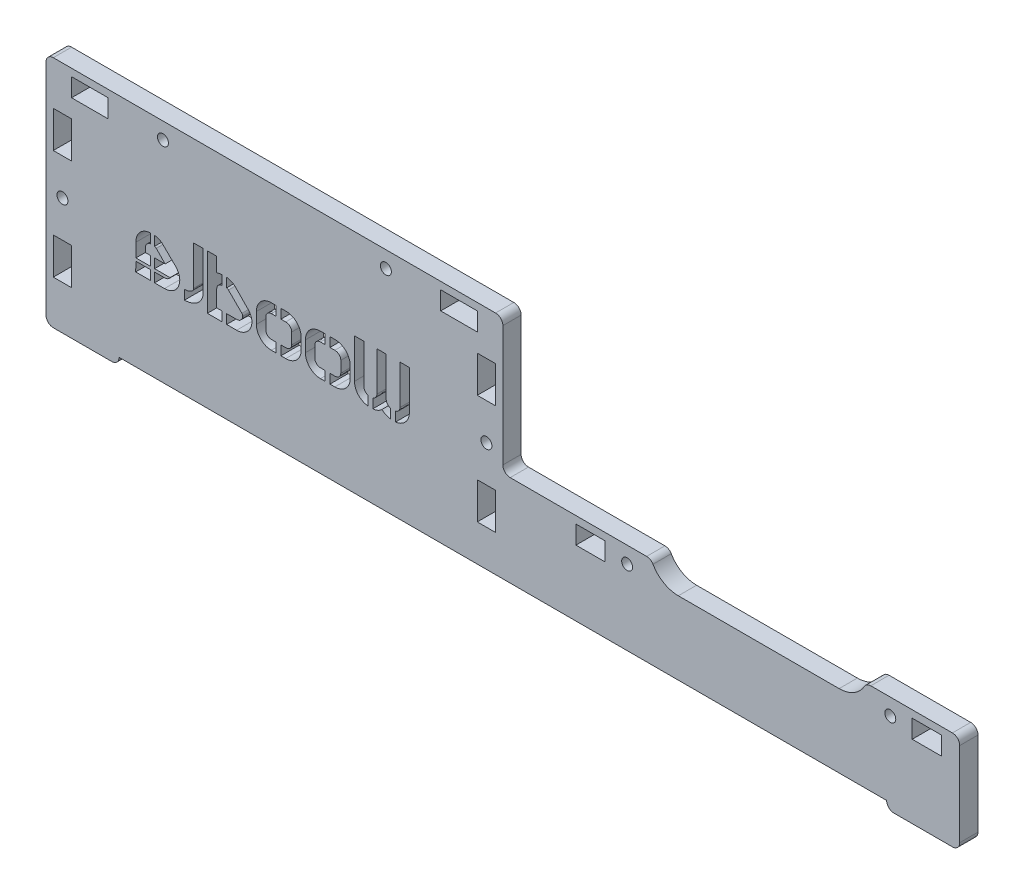
from build123d import *

# Parameters (mm, degrees)
BOSS_EXTRUDE1_DEPTH = 5
SKETCH2_R           = 1.5
SKETCH2_W           = 10
SKETCH2_H           = 5
SKETCH2_W_2         = 8
SKETCH2_W_3         = 5
SKETCH2_H_2         = 10
CUT_EXTRUDE1_DEPTH  = 259.110441478
SKETCH4_W           = 210
SKETCH4_H           = 2
CUT_EXTRUDE3_DEPTH  = 259.110441478
FILLET1_R           = 2
CUT_EXTRUDE4_DEPTH  = 259.110441478


with BuildPart() as part:
    # Sketch1 → Boss-Extrude1 (new body)
    with BuildSketch(Plane.XY):
        Polygon((0, 0), (0, 64), (125, 64), (125, 27), (250, 27), (250, 0), align=None)
    extrude(amount=BOSS_EXTRUDE1_DEPTH)

    # Sketch2 → Cut-Extrude1 (cut, through all)
    with BuildSketch(Plane.XY.offset(5)):
        with Locations((159, 22.5)):
            Circle(SKETCH2_R)
        with Locations(Location((231, 22.5, 0), (0, 0, 180))):
            Circle(SKETCH2_R)
        with Locations((120.5, 32)):
            Circle(SKETCH2_R)
        with Locations(Location((4.5, 32, 0), (0, 0, 180))):
            Circle(SKETCH2_R)
        with Locations((93, 59.5)):
            Circle(SKETCH2_R)
        with Locations(Location((32, 59.5, 0), (0, 0, 180))):
            Circle(SKETCH2_R)
        with Locations((12, 59.5)):
            Rectangle(SKETCH2_W, SKETCH2_H)
        with Locations((113, 59.5)):
            Rectangle(SKETCH2_W, SKETCH2_H)
        with Locations((241, 22.5)):
            Rectangle(SKETCH2_W_2, SKETCH2_H)
        with Locations((149, 22.5)):
            Rectangle(SKETCH2_W_2, SKETCH2_H)
        with Locations((120.5, 47)):
            Rectangle(SKETCH2_W_3, SKETCH2_H_2)
        with Locations((120.5, 17)):
            Rectangle(SKETCH2_W_3, SKETCH2_H_2)
        with Locations((4.5, 17)):
            Rectangle(SKETCH2_W_3, SKETCH2_H_2)
        with Locations((4.5, 47)):
            Rectangle(SKETCH2_W_3, SKETCH2_H_2)
        with BuildLine():
            Line((173, 22), (217, 22))
            ThreePointArc((217, 22), (225, 30), (217, 38))
            Line((217, 38), (173, 38))
            ThreePointArc((173, 38), (165, 30), (173, 22))
        make_face()
    extrude(amount=-CUT_EXTRUDE1_DEPTH, mode=Mode.SUBTRACT)

    # Sketch4 → Cut-Extrude3 (cut, through all)
    with BuildSketch(Plane.XY.offset(5)):
        with Locations((125, 1)):
            Rectangle(SKETCH4_W, SKETCH4_H)
    extrude(amount=-CUT_EXTRUDE3_DEPTH, mode=Mode.SUBTRACT)

    # Fillet1
    fillet1_edges = [part.edges().sort_by_distance(p)[0] for p in [
        (250, 0, 2.5),
        (250, 27, 2.5),
        (0, 0, 2.5),
        (125, 64, 2.5),
        (0, 64, 2.5),
        (125, 27, 2.5),
        (224.416198487, 27, 2.5),
        (165.583801513, 27, 2.5),
        (230, 0, 2.5),
        (20, 0, 2.5),
    ]]
    fillet(fillet1_edges, radius=FILLET1_R - 0.0001)  # a hair under: the kernel refuses the full size

    # Sketch5 → Cut-Extrude4 (cut, through all)
    with BuildSketch(Plane.XY.offset(5)):
        with BuildLine():
            add(Edge.make_bspline(
                [(90.526315789, 28.530633224), (90.52317309, 28.44800455), (90.51696156, 28.284689386), (90.454699796, 28.047497494), (90.358878759, 27.821672389), (90.222801605, 27.614523519), (90.058774914, 27.428168104), (89.863305687, 27.281251284), (89.652003493, 27.157508241), (89.495546745, 27.110991684), (89.416118421, 27.087376645)],
                knots=[0, 0, 0, 0, 1.010227084, 1.996708827, 2.983833333, 4.003745822, 5.020232118, 6.007597553, 6.988517975, 8, 8, 8, 8], degree=3))
            Line((89.416118421, 27.087376645), (89.416118421, 24.5))
            add(Edge.make_bspline(
                [(89.416118421, 24.5), (89.532483004, 24.513957205), (89.763361627, 24.541649655), (90.104345561, 24.608756184), (90.435530372, 24.706429474), (90.759545958, 24.824830878), (91.069862023, 24.97311561), (91.365921002, 25.145689998), (91.642011703, 25.350706729), (91.810588547, 25.506831888), (91.895559211, 25.585526316)],
                knots=[0, 0, 0, 0, 1.018810117, 2.021418134, 3.017070451, 4.018163531, 5.0176195, 6.003232589, 6.993535249, 8, 8, 8, 8], degree=3))
            add(Edge.make_bspline(
                [(91.895559211, 25.585526316), (92.067693526, 25.449668125), (92.415579674, 25.175096593), (92.90790607, 24.912313221), (93.321577862, 24.740758728), (93.640772924, 24.630066138), (93.970508455, 24.550542946), (94.194816296, 24.516866104), (94.307154605, 24.5)],
                knots=[0, 0, 0, 0, 1.470266527, 2.97143169, 3.726468338, 4.477360312, 5.237428497, 6, 6, 6, 6], degree=3))
            Line((94.307154605, 24.5), (94.307154605, 27.087376645))
            add(Edge.make_bspline(
                [(94.307154605, 27.087376645), (94.224819632, 27.111245566), (94.061011228, 27.158733647), (93.835641953, 27.280719426), (93.624839285, 27.428330364), (93.442563503, 27.6136278), (93.288177936, 27.820090708), (93.175710198, 28.045476839), (93.103326392, 28.283612842), (93.095864136, 28.447885914), (93.092105263, 28.530633224)],
                knots=[0, 0, 0, 0, 1.01260259, 2.014609424, 3.018094582, 4.051204175, 5.07884678, 6.058940596, 7.022253355, 8, 8, 8, 8], degree=3))
            Line((93.092105263, 28.530633224), (93.092105263, 39.302631579))
            Line((93.092105263, 39.302631579), (90.526315789, 39.302631579))
            Line((90.526315789, 39.302631579), (90.526315789, 28.530633224))
        make_face()
        with BuildLine():
            add(Edge.make_bspline(
                [(84.407894737, 28.530633224), (84.412002513, 28.400994106), (84.420117177, 28.14489981), (84.468190801, 27.764955091), (84.560149032, 27.398454323), (84.679650219, 27.043120334), (84.830571341, 26.702897231), (85.013346715, 26.38305727), (85.220965238, 26.080273746), (85.45803375, 25.800753805), (85.722248178, 25.543756552), (86.008147316, 25.309209303), (86.319872019, 25.10023342), (86.654532474, 24.921345661), (87.006587834, 24.763680601), (87.378042676, 24.64723719), (87.761446993, 24.550051061), (88.024787858, 24.516804587), (88.157894737, 24.5)],
                knots=[0, 0, 0, 0, 1.028666461, 2.032068855, 3.03088781, 4.021147977, 5.003147261, 5.978214699, 6.939579792, 7.911675967, 8.88048293, 9.859905496, 10.84149838, 11.852230519, 12.867361305, 13.896318637, 14.936684362, 16, 16, 16, 16], degree=3))
            Line((88.157894737, 24.5), (88.157894737, 27.087376645))
            add(Edge.make_bspline(
                [(88.157894737, 27.087376645), (88.075527751, 27.111158326), (87.912532832, 27.158219576), (87.68979943, 27.279974818), (87.484746079, 27.428730216), (87.308179966, 27.613734265), (87.1609978, 27.821263934), (87.049685243, 28.045061728), (86.986681982, 28.284645375), (86.978047921, 28.448048308), (86.973684211, 28.530633224)],
                knots=[0, 0, 0, 0, 1.022011913, 2.022445629, 3.015379681, 4.040857925, 5.06368216, 6.04744906, 7.013167921, 8, 8, 8, 8], degree=3))
            Line((86.973684211, 28.530633224), (86.973684211, 39.302631579))
            Line((86.973684211, 39.302631579), (84.407894737, 39.302631579))
            Line((84.407894737, 39.302631579), (84.407894737, 28.530633224))
        make_face()
        with BuildLine():
            add(Edge.make_bspline(
                [(96.842105263, 28.530633224), (96.837800239, 28.448023625), (96.829282297, 28.284571854), (96.765532622, 28.045783321), (96.658149625, 27.821460372), (96.513905697, 27.612854918), (96.337021169, 27.42893981), (96.131652796, 27.279047955), (95.90614863, 27.158316901), (95.741247414, 27.111195245), (95.657894737, 27.087376645)],
                knots=[0, 0, 0, 0, 0.985573412, 1.950060536, 2.927269449, 3.941761156, 4.965931442, 5.957599044, 6.967626846, 8, 8, 8, 8], degree=3))
            Line((95.657894737, 27.087376645), (95.657894737, 24.5))
            add(Edge.make_bspline(
                [(95.657894737, 24.5), (95.784844364, 24.516863113), (96.036973322, 24.550354184), (96.404900625, 24.647631245), (96.763867563, 24.764424078), (97.106155676, 24.920998845), (97.432726228, 25.10289721), (97.74328526, 25.308663917), (98.028983161, 25.545727226), (98.299406012, 25.800212892), (98.54190311, 26.081099452), (98.75952056, 26.38249344), (98.950452155, 26.703374361), (99.114959495, 27.041941875), (99.24382677, 27.397713629), (99.34079162, 27.764684121), (99.397374643, 28.144412517), (99.404361692, 28.400925719), (99.407894737, 28.530633224)],
                knots=[0, 0, 0, 0, 1.02041224, 2.026594961, 3.029967857, 4.028101524, 5.022727038, 6.009617966, 6.994326862, 7.980161472, 8.968175627, 9.948917217, 10.941614734, 11.942707234, 12.946482016, 13.954700296, 14.96578142, 16, 16, 16, 16], degree=3))
            Line((99.407894737, 28.530633224), (99.407894737, 39.302631579))
            Line((99.407894737, 39.302631579), (96.842105263, 39.302631579))
            Line((96.842105263, 39.302631579), (96.842105263, 28.530633224))
        make_face()
        with BuildLine():
            add(Edge.make_bspline(
                [(79.017269737, 33.184210526), (79.126808454, 33.179287767), (79.342284111, 33.169604116), (79.652394532, 33.080587387), (79.93524229, 32.931826201), (80.185278506, 32.73227072), (80.396021034, 32.494976093), (80.546154165, 32.224058285), (80.640506647, 31.931098369), (80.652038843, 31.727268498), (80.657894737, 31.623766447)],
                knots=[0, 0, 0, 0, 1.043825976, 2.053329579, 3.049585033, 4.076299473, 5.091651461, 6.058032298, 7.013895072, 8, 8, 8, 8], degree=3))
            Line((80.657894737, 31.623766447), (80.657894737, 28.586143092))
            add(Edge.make_bspline(
                [(80.657894737, 28.586143092), (80.651889296, 28.485761159), (80.64000189, 28.287061197), (80.547012767, 28.001444686), (80.393667653, 27.738824896), (80.186350023, 27.504856503), (79.933922506, 27.312288277), (79.652277284, 27.16584141), (79.341780074, 27.081237625), (79.126731394, 27.071000341), (79.017269737, 27.065789474)],
                knots=[0, 0, 0, 0, 0.968952361, 1.917982567, 2.870698946, 3.891457366, 4.918964356, 5.923292062, 6.942937516, 8, 8, 8, 8], degree=3))
            Line((79.017269737, 27.065789474), (77.694284539, 27.065789474))
            Line((77.694284539, 27.065789474), (77.694284539, 24.5))
            Line((77.694284539, 24.5), (79.017269737, 24.5))
            add(Edge.make_bspline(
                [(79.017269737, 24.5), (79.16443957, 24.50456345), (79.453783519, 24.513535442), (79.881030966, 24.57225931), (80.29128657, 24.675735026), (80.686814326, 24.812734303), (81.057262971, 24.990049839), (81.406858211, 25.190331919), (81.727792482, 25.422367684), (82.022371035, 25.682473868), (82.288033918, 25.969623798), (82.524239944, 26.28398503), (82.730090511, 26.623099838), (82.906857763, 26.984959644), (83.048311862, 27.365857354), (83.151211552, 27.762385908), (83.210066675, 28.173196398), (83.219102523, 28.451297692), (83.223684211, 28.592310855)],
                knots=[0, 0, 0, 0, 1.080806525, 2.124924803, 3.159392374, 4.183645534, 5.193357222, 6.170922564, 7.138880151, 8.096181651, 9.052411011, 10.006611931, 10.978916479, 11.961395482, 12.959812438, 13.957687, 14.964431228, 16, 16, 16, 16], degree=3))
            Line((83.223684211, 28.592310855), (83.223684211, 31.636101974))
            add(Edge.make_bspline(
                [(83.223684211, 31.636101974), (83.219116813, 31.780200922), (83.210107283, 32.06444679), (83.151025344, 32.484361504), (83.049548205, 32.888558024), (82.906000346, 33.274870261), (82.730913512, 33.641582265), (82.525020486, 33.983981105), (82.28800621, 34.298892312), (82.022231616, 34.585811636), (81.728829597, 34.846600387), (81.405608244, 35.074220331), (81.058929957, 35.276780543), (80.685673854, 35.445433887), (80.291346794, 35.581062478), (79.880547142, 35.679717556), (79.4539267, 35.740581156), (79.164472632, 35.746824782), (79.017269737, 35.75)],
                knots=[0, 0, 0, 0, 1.053003276, 2.077127084, 3.091951553, 4.09252401, 5.083718505, 6.05768351, 7.007210062, 7.958755116, 8.911367059, 9.870208281, 10.842984798, 11.841440058, 12.858208903, 13.885825724, 14.924829153, 16, 16, 16, 16], degree=3))
            Line((79.017269737, 35.75), (77.694284539, 35.75))
            Line((77.694284539, 35.75), (77.694284539, 33.184210526))
            Line((77.694284539, 33.184210526), (79.017269737, 33.184210526))
        make_face()
        with BuildLine():
            add(Edge.make_bspline(
                [(75.088404605, 35.75), (74.948411635, 35.746649784), (74.670258231, 35.739993207), (74.260766897, 35.680586344), (73.864803956, 35.579947582), (73.483689237, 35.445003987), (73.120067005, 35.275823475), (72.780345568, 35.07524435), (72.465966706, 34.845315976), (72.178426823, 34.586070661), (71.91982832, 34.296748404), (71.681639776, 33.985145895), (71.480298143, 33.640534542), (71.304276572, 33.275026017), (71.161046218, 32.888515489), (71.059482532, 32.484373021), (71.000423813, 32.064443804), (70.991411111, 31.780199918), (70.986842105, 31.636101974)],
                knots=[0, 0, 0, 0, 1.037637347, 2.061691803, 3.059976681, 4.062877695, 5.055208535, 6.029101085, 6.983469214, 7.938689241, 8.893909267, 9.857365668, 10.841701768, 11.847437394, 12.862688559, 13.892400818, 14.93154884, 16, 16, 16, 16], degree=3))
            Line((70.986842105, 31.636101974), (70.986842105, 28.592310855))
            add(Edge.make_bspline(
                [(70.986842105, 28.592310855), (70.991425357, 28.451298676), (71.000464289, 28.173199323), (71.059296837, 27.762374628), (71.162281095, 27.365899289), (71.303421198, 26.984803993), (71.481103333, 26.624145535), (71.682421586, 26.282813178), (71.919804233, 25.971770651), (72.178283477, 25.682215836), (72.467019602, 25.42363131), (72.779076161, 25.189330727), (73.121766996, 24.990988163), (73.482542928, 24.813201425), (73.864874503, 24.67686703), (74.260259052, 24.571380885), (74.670408681, 24.514139665), (74.948445793, 24.504734426), (75.088404605, 24.5)],
                knots=[0, 0, 0, 0, 1.050812842, 2.072376829, 3.084940585, 4.098054719, 5.094996286, 6.077650631, 7.045897848, 8.005867735, 8.965837622, 9.929498483, 10.908233743, 11.912067335, 12.92254273, 13.927690681, 14.956837279, 16, 16, 16, 16], degree=3))
            Line((75.088404605, 24.5), (76.303453947, 24.5))
            Line((76.303453947, 24.5), (76.303453947, 27.065789474))
            Line((76.303453947, 27.065789474), (75.088404605, 27.065789474))
            add(Edge.make_bspline(
                [(75.088404605, 27.065789474), (74.985020817, 27.070821072), (74.782911545, 27.080657552), (74.491341931, 27.167546057), (74.227022901, 27.31182598), (73.991926766, 27.506403131), (73.801462473, 27.741901815), (73.65342143, 28.001725506), (73.568296414, 28.287972143), (73.557898164, 28.485896742), (73.552631579, 28.586143092)],
                knots=[0, 0, 0, 0, 1.031941725, 2.01738583, 3.010730696, 4.025329363, 5.047861792, 6.023177512, 6.998763965, 8, 8, 8, 8], degree=3))
            Line((73.552631579, 28.586143092), (73.552631579, 31.623766447))
            add(Edge.make_bspline(
                [(73.552631579, 31.623766447), (73.557757279, 31.727131111), (73.567826728, 31.93019124), (73.654264604, 32.223818131), (73.799217188, 32.491805913), (73.993026979, 32.730789113), (74.225669065, 32.932212877), (74.491241178, 33.078849443), (74.782369991, 33.170180852), (74.984937421, 33.179467236), (75.088404605, 33.184210526)],
                knots=[0, 0, 0, 0, 1.018371753, 2.00059374, 2.989808205, 4.00676471, 5.021087658, 6.006237912, 6.981628247, 8, 8, 8, 8], degree=3))
            Line((75.088404605, 33.184210526), (76.303453947, 33.184210526))
            Line((76.303453947, 33.184210526), (76.303453947, 35.75))
            Line((76.303453947, 35.75), (75.088404605, 35.75))
        make_face()
        with BuildLine():
            add(Edge.make_bspline(
                [(65.596217105, 33.184210526), (65.705755822, 33.179287767), (65.921231479, 33.169604116), (66.231341901, 33.080587387), (66.514189659, 32.931826201), (66.764225874, 32.73227072), (66.974968402, 32.494976093), (67.125101534, 32.224058285), (67.219454015, 31.931098369), (67.230986212, 31.727268498), (67.236842105, 31.623766447)],
                knots=[0, 0, 0, 0, 1.043825976, 2.053329579, 3.049585033, 4.076299473, 5.091651461, 6.058032298, 7.013895072, 8, 8, 8, 8], degree=3))
            Line((67.236842105, 31.623766447), (67.236842105, 28.586143092))
            add(Edge.make_bspline(
                [(67.236842105, 28.586143092), (67.230836665, 28.485761159), (67.218949259, 28.287061197), (67.125960136, 28.001444686), (66.972615021, 27.738824896), (66.765297391, 27.504856503), (66.512869874, 27.312288277), (66.231224653, 27.16584141), (65.920727442, 27.081237625), (65.705678762, 27.071000341), (65.596217105, 27.065789474)],
                knots=[0, 0, 0, 0, 0.968952361, 1.917982567, 2.870698946, 3.891457366, 4.918964356, 5.923292062, 6.942937516, 8, 8, 8, 8], degree=3))
            Line((65.596217105, 27.065789474), (64.273231908, 27.065789474))
            Line((64.273231908, 27.065789474), (64.273231908, 24.5))
            Line((64.273231908, 24.5), (65.596217105, 24.5))
            add(Edge.make_bspline(
                [(65.596217105, 24.5), (65.743386938, 24.50456345), (66.032730887, 24.513535442), (66.459978334, 24.57225931), (66.870233939, 24.675735026), (67.265761694, 24.812734303), (67.63621034, 24.990049839), (67.985805579, 25.190331919), (68.306739851, 25.422367684), (68.601318404, 25.682473868), (68.866981286, 25.969623798), (69.103187312, 26.28398503), (69.30903788, 26.623099838), (69.485805131, 26.984959644), (69.62725923, 27.365857354), (69.730158921, 27.762385908), (69.789014044, 28.173196398), (69.798049891, 28.451297692), (69.802631579, 28.592310855)],
                knots=[0, 0, 0, 0, 1.080806525, 2.124924803, 3.159392374, 4.183645534, 5.193357222, 6.170922564, 7.138880151, 8.096181651, 9.052411011, 10.006611931, 10.978916479, 11.961395482, 12.959812438, 13.957687, 14.964431228, 16, 16, 16, 16], degree=3))
            Line((69.802631579, 28.592310855), (69.802631579, 31.636101974))
            add(Edge.make_bspline(
                [(69.802631579, 31.636101974), (69.798064181, 31.780200922), (69.789054651, 32.06444679), (69.729972712, 32.484361504), (69.628495574, 32.888558024), (69.484947714, 33.274870261), (69.30986088, 33.641582265), (69.103967855, 33.983981105), (68.866953578, 34.298892312), (68.601178984, 34.585811636), (68.307776965, 34.846600387), (67.984555613, 35.074220331), (67.637877326, 35.276780543), (67.264621222, 35.445433887), (66.870294162, 35.581062478), (66.459494511, 35.679717556), (66.032874068, 35.740581156), (65.743420001, 35.746824782), (65.596217105, 35.75)],
                knots=[0, 0, 0, 0, 1.053003276, 2.077127084, 3.091951553, 4.09252401, 5.083718505, 6.05768351, 7.007210062, 7.958755116, 8.911367059, 9.870208281, 10.842984798, 11.841440058, 12.858208903, 13.885825724, 14.924829153, 16, 16, 16, 16], degree=3))
            Line((65.596217105, 35.75), (64.273231908, 35.75))
            Line((64.273231908, 35.75), (64.273231908, 33.184210526))
            Line((64.273231908, 33.184210526), (65.596217105, 33.184210526))
        make_face()
        with BuildLine():
            add(Edge.make_bspline(
                [(61.667351974, 35.75), (61.527359003, 35.746649784), (61.249205599, 35.739993207), (60.839714266, 35.680586344), (60.443751324, 35.579947582), (60.062636605, 35.445003987), (59.699014374, 35.275823475), (59.359292937, 35.07524435), (59.044914075, 34.845315976), (58.757374192, 34.586070661), (58.498775688, 34.296748404), (58.260587144, 33.985145895), (58.059245512, 33.640534542), (57.883223941, 33.275026017), (57.739993587, 32.888515489), (57.6384299, 32.484373021), (57.579371182, 32.064443804), (57.570358479, 31.780199918), (57.565789474, 31.636101974)],
                knots=[0, 0, 0, 0, 1.037637347, 2.061691803, 3.059976681, 4.062877695, 5.055208535, 6.029101085, 6.983469214, 7.938689241, 8.893909267, 9.857365668, 10.841701768, 11.847437394, 12.862688559, 13.892400818, 14.93154884, 16, 16, 16, 16], degree=3))
            Line((57.565789474, 31.636101974), (57.565789474, 28.592310855))
            add(Edge.make_bspline(
                [(57.565789474, 28.592310855), (57.570372726, 28.451298676), (57.579411657, 28.173199323), (57.638244205, 27.762374628), (57.741228463, 27.365899289), (57.882368567, 26.984803993), (58.060050702, 26.624145535), (58.261368954, 26.282813178), (58.498751602, 25.971770651), (58.757230846, 25.682215836), (59.04596697, 25.42363131), (59.358023529, 25.189330727), (59.700714364, 24.990988163), (60.061490297, 24.813201425), (60.443821871, 24.67686703), (60.83920642, 24.571380885), (61.249356049, 24.514139665), (61.527393161, 24.504734426), (61.667351974, 24.5)],
                knots=[0, 0, 0, 0, 1.050812842, 2.072376829, 3.084940585, 4.098054719, 5.094996286, 6.077650631, 7.045897848, 8.005867735, 8.965837622, 9.929498483, 10.908233743, 11.912067335, 12.92254273, 13.927690681, 14.956837279, 16, 16, 16, 16], degree=3))
            Line((61.667351974, 24.5), (62.882401316, 24.5))
            Line((62.882401316, 24.5), (62.882401316, 27.065789474))
            Line((62.882401316, 27.065789474), (61.667351974, 27.065789474))
            add(Edge.make_bspline(
                [(61.667351974, 27.065789474), (61.563968185, 27.070821072), (61.361858913, 27.080657552), (61.0702893, 27.167546057), (60.805970269, 27.31182598), (60.570874135, 27.506403131), (60.380409841, 27.741901815), (60.232368799, 28.001725506), (60.147243782, 28.287972143), (60.136845532, 28.485896742), (60.131578947, 28.586143092)],
                knots=[0, 0, 0, 0, 1.031941725, 2.01738583, 3.010730696, 4.025329363, 5.047861792, 6.023177512, 6.998763965, 8, 8, 8, 8], degree=3))
            Line((60.131578947, 28.586143092), (60.131578947, 31.623766447))
            add(Edge.make_bspline(
                [(60.131578947, 31.623766447), (60.136704647, 31.727131111), (60.146774097, 31.93019124), (60.233211973, 32.223818131), (60.378164557, 32.491805913), (60.571974348, 32.730789113), (60.804616434, 32.932212877), (61.070188546, 33.078849443), (61.361317359, 33.170180852), (61.563884789, 33.179467236), (61.667351974, 33.184210526)],
                knots=[0, 0, 0, 0, 1.018371753, 2.00059374, 2.989808205, 4.00676471, 5.021087658, 6.006237912, 6.981628247, 8, 8, 8, 8], degree=3))
            Line((61.667351974, 33.184210526), (62.882401316, 33.184210526))
            Line((62.882401316, 33.184210526), (62.882401316, 35.75))
            Line((62.882401316, 35.75), (61.667351974, 35.75))
        make_face()
        with BuildLine():
            Line((48.092105263, 27.065789474), (46.710526316, 27.065789474))
            Line((46.710526316, 27.065789474), (46.710526316, 31.583675987))
            add(Edge.make_bspline(
                [(46.710526316, 31.583675987), (46.714947311, 31.679810263), (46.723597131, 31.867900112), (46.801541026, 32.138971905), (46.925925916, 32.389742475), (47.1004858, 32.612786787), (47.306199449, 32.807667193), (47.546716213, 32.953802259), (47.809140187, 33.060086718), (47.996596756, 33.089197671), (48.092105263, 33.104029605)],
                knots=[0, 0, 0, 0, 1.022761326, 2.001065903, 2.98108702, 3.989187733, 5.004881638, 5.983983554, 6.97284623, 8, 8, 8, 8], degree=3))
            Line((48.092105263, 33.104029605), (48.092105263, 35.638980263))
            add(Edge.make_bspline(
                [(48.092105263, 35.638980263), (47.964489878, 35.630120539), (47.718922351, 35.613071965), (47.36289489, 35.565165689), (47.026986214, 35.505064147), (46.814802524, 35.437707313), (46.710526316, 35.404605263)],
                knots=[0, 0, 0, 0, 1.091901524, 2.10112249, 3.066809764, 4, 4, 4, 4], degree=3))
            Line((46.710526316, 35.404605263), (46.710526316, 39.302631579))
            Line((46.710526316, 39.302631579), (44.144736842, 39.302631579))
            Line((44.144736842, 39.302631579), (44.144736842, 24.5))
            Line((44.144736842, 24.5), (48.092105263, 24.5))
            Line((48.092105263, 24.5), (48.092105263, 27.065789474))
        make_face()
        with BuildLine():
            add(Edge.make_bspline(
                [(52.156661184, 24.5), (52.296640734, 24.504624784), (52.573701549, 24.513778597), (52.984525045, 24.572596956), (53.382414315, 24.676136514), (53.768436215, 24.813548211), (54.133613318, 24.99013266), (54.479465102, 25.19522973), (54.802826833, 25.429224178), (55.103113797, 25.691622105), (55.37498596, 25.981809544), (55.616427988, 26.29878421), (55.829296608, 26.638262341), (56.012483828, 26.999575393), (56.158181348, 27.381578798), (56.258860962, 27.78227286), (56.322752727, 28.197584298), (56.331094018, 28.480029059), (56.335320724, 28.623149671)],
                knots=[0, 0, 0, 0, 1.030836197, 2.040328881, 3.048259431, 4.053913456, 5.05270677, 6.030248274, 7.011417249, 7.987697692, 8.962392167, 9.934378662, 10.917298058, 11.909183209, 12.912983755, 13.920914305, 14.946484204, 16, 16, 16, 16], degree=3))
            add(Edge.make_bspline(
                [(56.335320724, 28.623149671), (56.33050681, 28.733350302), (56.320769897, 28.956248741), (56.261508991, 29.291308191), (56.156477354, 29.625878595), (56.019323349, 29.958240834), (55.85096567, 30.280349106), (55.655089985, 30.581492346), (55.444489594, 30.865433806), (55.283460377, 31.034230444), (55.203536184, 31.118009868)],
                knots=[0, 0, 0, 0, 0.943171208, 1.907714943, 2.901026669, 3.938269626, 4.980869203, 6.00561774, 7.0101213, 8, 8, 8, 8], degree=3))
            add(Edge.make_bspline(
                [(55.203536184, 31.118009868), (54.922966761, 31.41613843), (54.358424519, 32.016011948), (53.489992996, 32.898484539), (52.615194912, 33.774354926), (52.038996658, 34.362808283), (51.752672697, 34.655222039)],
                knots=[0, 0, 0, 0, 0.994061606, 2.000181492, 3.006251836, 4, 4, 4, 4], degree=3))
            add(Edge.make_bspline(
                [(51.752672697, 34.655222039), (51.687760505, 34.713840813), (51.548654616, 34.839459996), (51.308816651, 35.015718198), (51.034275848, 35.186516358), (50.726677662, 35.333088412), (50.402472156, 35.45904674), (50.07273829, 35.573883594), (49.748024337, 35.663801426), (49.530680592, 35.68878759), (49.427425987, 35.700657895)],
                knots=[0, 0, 0, 0, 0.810069558, 1.735967344, 2.753782946, 3.801817255, 4.887904665, 5.975369697, 7.038148522, 8, 8, 8, 8], degree=3))
            Line((49.427425987, 35.700657895), (49.427425987, 33.162623355))
            add(Edge.make_bspline(
                [(49.427425987, 33.162623355), (49.521253075, 33.137138483), (49.703582465, 33.087615032), (49.847773253, 32.96579323), (49.917763158, 32.906661184)],
                knots=[0, 0, 0, 0, 1.029204218, 2, 2, 2, 2], degree=3))
            add(Edge.make_bspline(
                [(49.917763158, 32.906661184), (50.128632913, 32.69709546), (50.531295614, 32.29692285), (51.104006735, 31.72345531), (51.621941338, 31.205206925), (52.088939219, 30.739839556), (52.508230445, 30.315183225), (52.892799421, 29.931861483), (53.247300766, 29.577070601), (53.474497922, 29.349909138), (53.584498355, 29.239925987)],
                knots=[0, 0, 0, 0, 1.375948511, 2.627418722, 3.751050578, 4.767029082, 5.678724609, 6.513038083, 7.280068212, 8, 8, 8, 8], degree=3))
            add(Edge.make_bspline(
                [(53.584498355, 29.239925987), (53.617425017, 29.201193591), (53.686295414, 29.120179746), (53.751713168, 28.964257692), (53.792436228, 28.781545803), (53.795597831, 28.650145492), (53.797286184, 28.579975329)],
                knots=[0, 0, 0, 0, 0.853961671, 1.78617196, 2.817775449, 4, 4, 4, 4], degree=3))
            add(Edge.make_bspline(
                [(53.797286184, 28.579975329), (53.791599389, 28.479477842), (53.780453737, 28.282510993), (53.683947031, 27.999468135), (53.535228595, 27.736270847), (53.324416622, 27.504949195), (53.073500527, 27.312140957), (52.791618677, 27.165880933), (52.481184654, 27.081227255), (52.266127271, 27.070996843), (52.156661184, 27.065789474)],
                knots=[0, 0, 0, 0, 0.971104243, 1.903284826, 2.866750735, 3.882332976, 4.912121888, 5.918680039, 6.940589956, 8, 8, 8, 8], degree=3))
            Line((52.156661184, 27.065789474), (49.427425987, 27.065789474))
            Line((49.427425987, 27.065789474), (49.427425987, 24.5))
            Line((49.427425987, 24.5), (52.156661184, 24.5))
        make_face()
        with BuildLine():
            Line((40.394736842, 39.302631579), (40.394736842, 28.567639803))
            add(Edge.make_bspline(
                [(40.394736842, 28.567639803), (40.392385922, 28.516009375), (40.387670572, 28.412451821), (40.348856477, 28.261857951), (40.290013182, 28.116716506), (40.17382955, 27.931457346), (39.97370352, 27.715399426), (39.668248895, 27.489084812), (39.292435896, 27.308691143), (38.865030221, 27.167254284), (38.393656035, 27.0803431), (38.066770049, 27.070708481), (37.899876645, 27.065789474)],
                knots=[0, 0, 0, 0, 0.485141942, 0.973071803, 1.454439018, 1.953739644, 3.022040114, 4.20395727, 5.510241927, 6.926347096, 8.430729922, 10, 10, 10, 10], degree=3))
            Line((37.899876645, 27.065789474), (37.899876645, 24.5))
            add(Edge.make_bspline(
                [(37.899876645, 24.5), (38.071756642, 24.502918487), (38.412548898, 24.50870507), (38.915460823, 24.57427307), (39.404843321, 24.671046411), (39.874926304, 24.809978673), (40.321566342, 24.983225351), (40.741582674, 25.181856133), (41.129201264, 25.411714416), (41.48576008, 25.667075572), (41.805942421, 25.952247013), (42.096823477, 26.258645256), (42.34903843, 26.593872355), (42.570549941, 26.949549916), (42.741601425, 27.329871285), (42.870604039, 27.723040448), (42.946390666, 28.130927057), (42.955790427, 28.406972458), (42.960526316, 28.546052632)],
                knots=[0, 0, 0, 0, 1.148217981, 2.276610438, 3.3842901, 4.480099663, 5.548133976, 6.583851855, 7.581963842, 8.55645292, 9.510525177, 10.443835217, 11.375575775, 12.310073828, 13.238692883, 14.155672564, 15.070771048, 16, 16, 16, 16], degree=3))
            Line((42.960526316, 28.546052632), (42.960526316, 39.302631579))
            Line((42.960526316, 39.302631579), (40.394736842, 39.302631579))
        make_face()
        with BuildLine():
            Line((32.589432566, 30.421052632), (29.712171053, 30.421052632))
            Line((29.712171053, 30.421052632), (29.712171053, 27.855263158))
            Line((29.712171053, 27.855263158), (33.934004934, 27.855263158))
            add(Edge.make_bspline(
                [(33.934004934, 27.855263158), (33.901865334, 27.799561002), (33.836166345, 27.685696013), (33.701561486, 27.535015053), (33.53695306, 27.401233908), (33.348623753, 27.281510244), (33.134969178, 27.187606583), (32.907871304, 27.115552247), (32.666860342, 27.075888175), (32.503215889, 27.069198619), (32.419819079, 27.065789474)],
                knots=[0, 0, 0, 0, 0.860078926, 1.758152369, 2.687688369, 3.696714125, 4.738770742, 5.806285518, 6.882034885, 8, 8, 8, 8], degree=3))
            Line((32.419819079, 27.065789474), (29.712171053, 27.065789474))
            Line((29.712171053, 27.065789474), (29.712171053, 24.5))
            Line((29.712171053, 24.5), (32.419819079, 24.5))
            add(Edge.make_bspline(
                [(32.419819079, 24.5), (32.565947554, 24.504681238), (32.855254029, 24.513949195), (33.281651601, 24.571557656), (33.690831634, 24.67572225), (34.083087261, 24.813025004), (34.452989601, 24.989847186), (34.798731095, 25.196492678), (35.11943335, 25.431357948), (35.408405499, 25.69833895), (35.673645728, 25.988233023), (35.902514729, 26.307623917), (36.109316172, 26.646523083), (36.285383971, 27.009130599), (36.422777284, 27.395217233), (36.526554927, 27.797284463), (36.584746733, 28.216439324), (36.593859092, 28.500653805), (36.598478618, 28.644736842)],
                knots=[0, 0, 0, 0, 1.069398265, 2.117204337, 3.140644575, 4.15411307, 5.153386037, 6.135065398, 7.097890291, 8.056209303, 9.009467126, 9.967845176, 10.926311773, 11.912017256, 12.911318532, 13.920170855, 14.945626909, 16, 16, 16, 16], degree=3))
            add(Edge.make_bspline(
                [(36.598478618, 28.644736842), (36.596154417, 28.754988296), (36.591500855, 28.975735958), (36.533733385, 29.302137441), (36.456934207, 29.627081935), (36.335836132, 29.940985521), (36.200399043, 30.246587691), (36.044763619, 30.532291981), (35.882216302, 30.800535404), (35.760885073, 30.965669763), (35.701069079, 31.047080592)],
                knots=[0, 0, 0, 0, 1.012978646, 2.028206055, 3.041978951, 4.080201473, 5.117217361, 6.115746689, 7.071067793, 8, 8, 8, 8], degree=3))
            Line((35.701069079, 31.047080592), (31.994243421, 34.698396382))
            add(Edge.make_bspline(
                [(31.994243421, 34.698396382), (31.920604872, 34.768901835), (31.771607777, 34.911559559), (31.520047325, 35.097119739), (31.249319902, 35.268829149), (30.959773896, 35.420937472), (30.65620322, 35.551114602), (30.345048483, 35.648691677), (30.030476466, 35.719763998), (29.818384981, 35.739910682), (29.712171053, 35.75)],
                knots=[0, 0, 0, 0, 0.953525925, 1.929323628, 2.919815636, 3.952913488, 4.987802582, 6.007365816, 7.002102776, 8, 8, 8, 8], degree=3))
            Line((29.712171053, 35.75), (29.712171053, 33.150287829))
            add(Edge.make_bspline(
                [(29.712171053, 33.150287829), (29.754941484, 33.14534218), (29.840109884, 33.13549395), (29.959549123, 33.079243194), (30.079369118, 33.011741295), (30.146339959, 32.944477454), (30.180921053, 32.909745066)],
                knots=[0, 0, 0, 0, 0.95251899, 1.896743027, 2.913961255, 4, 4, 4, 4], degree=3))
            Line((30.180921053, 32.909745066), (32.589432566, 30.421052632))
        make_face()
        with BuildLine():
            Line((24.605263158, 27.855263158), (28.552631579, 27.855263158))
            Line((28.552631579, 27.855263158), (28.552631579, 30.421052632))
            Line((28.552631579, 30.421052632), (27.171052632, 30.421052632))
            Line((27.171052632, 30.421052632), (27.171052632, 31.574424342))
            add(Edge.make_bspline(
                [(27.171052632, 31.574424342), (27.175654776, 31.672546456), (27.184706666, 31.865541355), (27.260765035, 32.144843817), (27.389674492, 32.402038378), (27.566954424, 32.630224632), (27.772525239, 32.831936058), (28.011639484, 32.984125386), (28.272392046, 33.093943376), (28.458110658, 33.125152431), (28.552631579, 33.141036184)],
                knots=[0, 0, 0, 0, 1.029899045, 2.025692833, 3.016081045, 4.033726075, 5.04993663, 6.0267995, 6.99574562, 8, 8, 8, 8], degree=3))
            Line((28.552631579, 33.141036184), (28.552631579, 35.75))
            add(Edge.make_bspline(
                [(28.552631579, 35.75), (28.41463962, 35.742370024), (28.143272548, 35.727365349), (27.74451873, 35.659433707), (27.363948392, 35.546599868), (26.999406249, 35.39859054), (26.654371403, 35.216104709), (26.330302254, 35.00535666), (26.024502976, 34.770749696), (25.74657158, 34.504585287), (25.486879279, 34.218504646), (25.263031764, 33.902416224), (25.066508396, 33.562930629), (24.901765521, 33.201351704), (24.76743839, 32.819967019), (24.672358719, 32.422216934), (24.615621098, 32.008842351), (24.608748759, 31.728796917), (24.605263158, 31.586759868)],
                knots=[0, 0, 0, 0, 1.042773734, 2.050659023, 3.045221338, 4.033801315, 5.01617864, 5.98696263, 6.94936676, 7.92101885, 8.888353777, 9.861739746, 10.838738351, 11.845786774, 12.856953046, 13.88653357, 14.928064891, 16, 16, 16, 16], degree=3))
            Line((24.605263158, 31.586759868), (24.605263158, 27.855263158))
        make_face()
        Polygon((24.605263158, 27.065789474), (24.53125, 24.5), (28.552631579, 24.5), (28.552631579, 27.065789474), align=None)
    extrude(amount=-CUT_EXTRUDE4_DEPTH, mode=Mode.SUBTRACT)


solid = part.part
